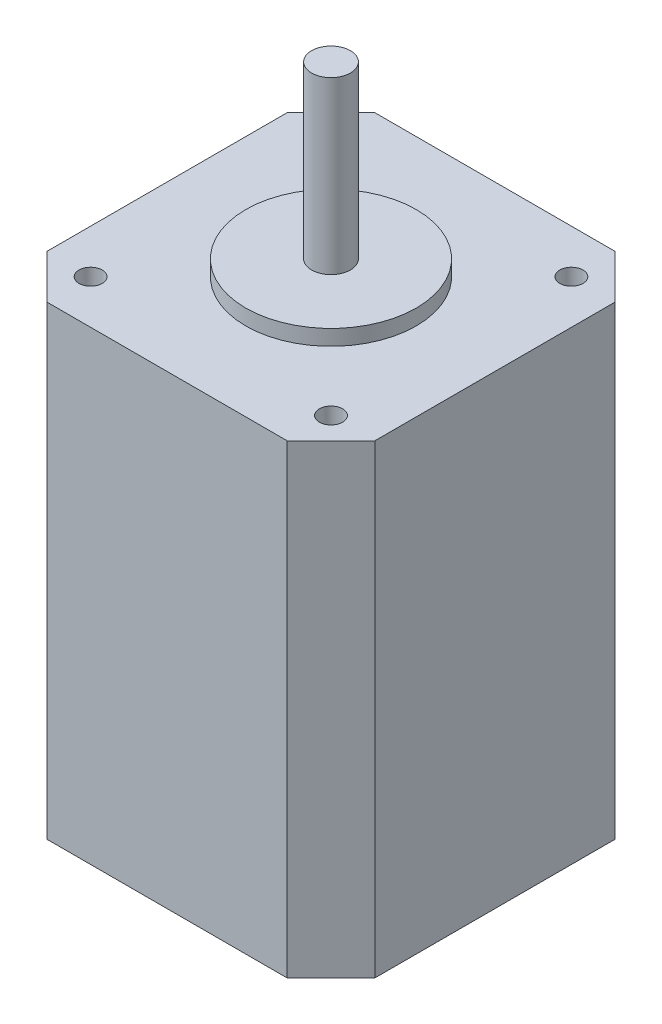
from build123d import *

# Parameters (mm, degrees)
SKETCH_1_R      = 1.5
EXTRUDE_1_DEPTH = 60
SKETCH_2_R      = 11
EXTRUDE_2_DEPTH = 2
SKETCH_3_R      = 2.5
EXTRUDE_3_DEPTH = 22


with BuildPart() as part:
    # 草圖1 → 填料-伸長1 (new body)
    with BuildSketch(Plane(origin=(0, 0, 0), x_dir=(1, 0, 0), z_dir=(0, 1, 0))):
        Polygon((-15.5, 21.15), (15.5, 21.15), (21.15, 15.5), (21.15, -15.5), (15.5, -21.15), (-15.5, -21.15), (-21.15, -15.5), (-21.15, 15.5), align=None)
        with Locations((-15.5, 15.5)):
            Circle(SKETCH_1_R, mode=Mode.SUBTRACT)
        with Locations((15.5, 15.5)):
            Circle(SKETCH_1_R, mode=Mode.SUBTRACT)
        with Locations((15.5, -15.5)):
            Circle(SKETCH_1_R, mode=Mode.SUBTRACT)
        with Locations((-15.5, -15.5)):
            Circle(SKETCH_1_R, mode=Mode.SUBTRACT)
    extrude(amount=EXTRUDE_1_DEPTH)

    # 草圖2 → 填料-伸長2 (add)
    with BuildSketch(Plane(origin=(0, 60, 0), x_dir=(1, 0, 0), z_dir=(0, 1, 0))):
        Circle(SKETCH_2_R)
    extrude(amount=EXTRUDE_2_DEPTH)

    # 草圖3 → 填料-伸長3 (add)
    with BuildSketch(Plane(origin=(0, 62, 0), x_dir=(1, 0, 0), z_dir=(0, 1, 0))):
        Circle(SKETCH_3_R)
    extrude(amount=EXTRUDE_3_DEPTH)


solid = part.part
